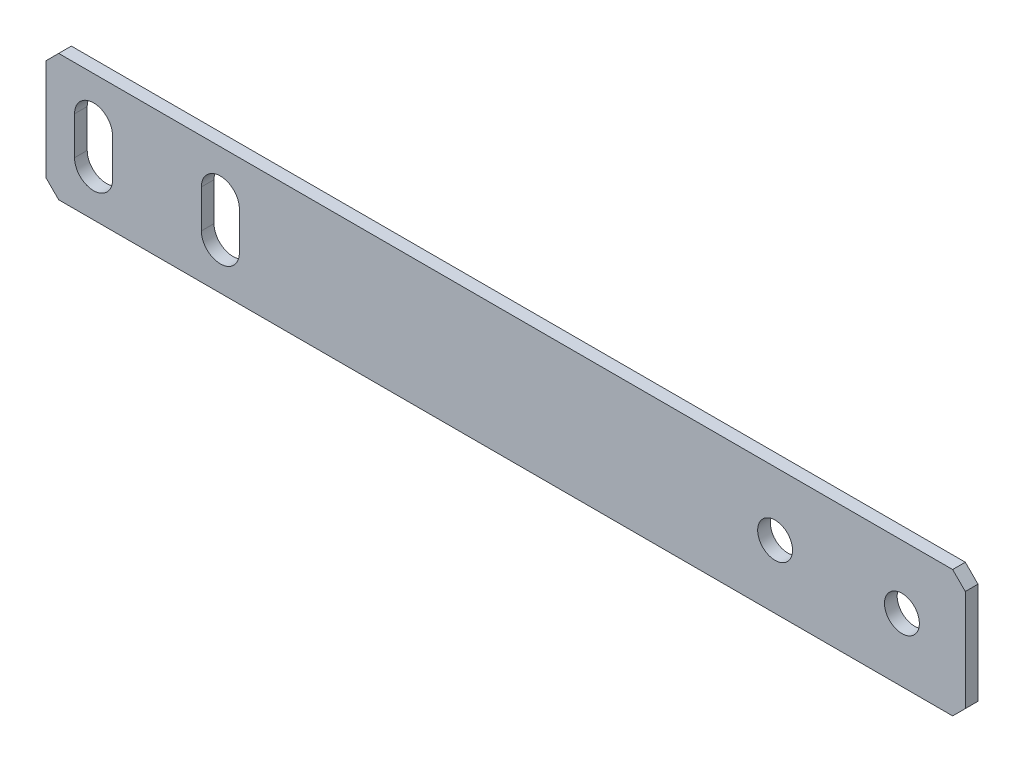
from build123d import *

# Parameters (mm, degrees)
SKETCH1_W           = 145
SKETCH1_H           = 20
SKETCH1_R           = 2.75
BOSS_EXTRUDE1_DEPTH = 2
CHAMFER1_SIZE       = 2


with BuildPart() as part:
    # Sketch1 → Boss-Extrude1 (new body)
    with BuildSketch(Plane.XY):
        Rectangle(SKETCH1_W, SKETCH1_H)
        with Locations((62.5, 0)):
            Circle(SKETCH1_R, mode=Mode.SUBTRACT)
        with Locations((42.5, 0)):
            Circle(SKETCH1_R, mode=Mode.SUBTRACT)
        with BuildLine():
            Line((-68, -3), (-68, 3))
            ThreePointArc((-68, 3), (-65, 6), (-62, 3))
            Line((-62, 3), (-62, -3))
            ThreePointArc((-62, -3), (-65, -6), (-68, -3))
        make_face(mode=Mode.SUBTRACT)
        with BuildLine():
            Line((-48, -3), (-48, 3))
            ThreePointArc((-48, 3), (-45, 6), (-42, 3))
            Line((-42, 3), (-42, -3))
            ThreePointArc((-42, -3), (-45, -6), (-48, -3))
        make_face(mode=Mode.SUBTRACT)
    extrude(amount=BOSS_EXTRUDE1_DEPTH)

    # Chamfer1
    chamfer1_edges = [part.edges().sort_by_distance(p)[0] for p in [
        (-72.5, -10, 1),
        (72.5, -10, 1),
        (72.5, 10, 1),
        (-72.5, 10, 1),
    ]]
    chamfer(chamfer1_edges, length=CHAMFER1_SIZE)


solid = part.part
